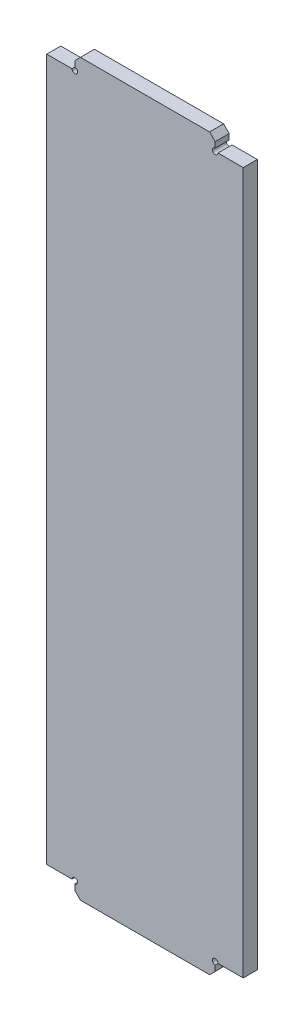
from build123d import *

# Parameters (mm, degrees)
EXTRUDE_1_DEPTH = 2.5


with BuildPart() as part:
    # 草圖1 → 填料-伸長1 (new, symmetric)
    with BuildSketch(Plane.XY):
        with BuildLine():
            Line((-25, 2), (-23, 0))
            Line((-23, 0), (23, 0))
            Line((23, 0), (25, 2))
            Line((25, 2), (25, 4))
            ThreePointArc((25, 4), (24.292893219, 5.707106781), (26, 5))
            Line((26, 5), (35, 5))
            Line((35, 5), (35, 255))
            Line((35, 255), (26, 255))
            ThreePointArc((26, 255), (24.292893219, 254.292893219), (25, 256))
            Line((25, 256), (25, 258))
            Line((25, 258), (23, 260))
            Line((23, 260), (-23, 260))
            Line((-23, 260), (-25, 258))
            Line((-25, 258), (-25, 256))
            ThreePointArc((-25, 256), (-24.292893219, 254.292893219), (-26, 255))
            Line((-26, 255), (-35, 255))
            Line((-35, 255), (-35, 5))
            Line((-35, 5), (-26, 5))
            ThreePointArc((-26, 5), (-24.292893219, 5.707106781), (-25, 4))
            Line((-25, 4), (-25, 2))
        make_face()
    extrude(amount=EXTRUDE_1_DEPTH, both=True)


solid = part.part
